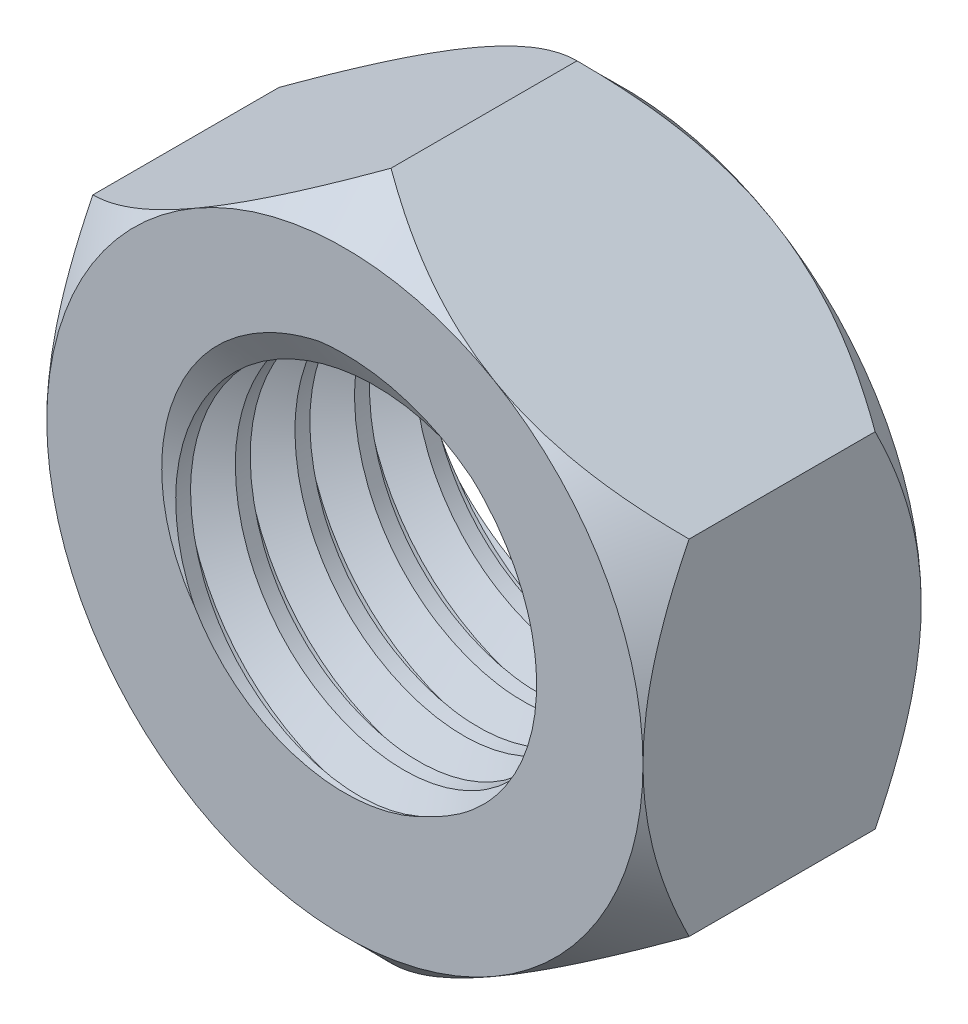
from build123d import *

# Parameters (mm, degrees)
SKETCH1_R               = 1.75
BOSS_EXTRUDE1_DEPTH     = 1.4
SKETCH3_OUTSIDE_W       = 15.516
SKETCH3_OUTSIDE_H       = 16.444
SKETCH3_OUTSIDE_R       = 3
CUT_EXTRUDE1_DEPTH      = 2.8
CUT_EXTRUDE1_DRAFT      = -45
MIRROR1_COPY_1_SKETCH_W = 15.516
MIRROR1_COPY_1_SKETCH_H = 16.444
MIRROR1_COPY_1_SKETCH_R = 3
MIRROR1_COPY_1_DEPTH    = 2.8
MIRROR1_COPY_1_DRAFT    = -45
THREAD1_PITCH           = 0.6


with BuildPart() as part:
    # Sketch1 → Boss-Extrude1 (new, symmetric)
    with BuildSketch(Plane.XY):
        Polygon((0, -3.464101615), (3, -1.732050808), (3, 1.732050808), (0, 3.464101615), (-3, 1.732050808), (-3, -1.732050808), align=None)
        Circle(SKETCH1_R, mode=Mode.SUBTRACT)
    extrude(amount=BOSS_EXTRUDE1_DEPTH, both=True)


with BuildPart() as cut_extrude1_tool:
    # Sketch3 outside → Cut-Extrude1 (with draft: the straight prism first)
    with BuildSketch(Plane.XY.offset(1.4)):
        Rectangle(SKETCH3_OUTSIDE_W, SKETCH3_OUTSIDE_H)
        Circle(SKETCH3_OUTSIDE_R, mode=Mode.SUBTRACT)
    extrude(amount=-CUT_EXTRUDE1_DEPTH)
    # Cut-Extrude1: the draft: its side faces are tilted about the plane it starts from
    cut_extrude1_sides = [cut_extrude1_tool.faces().sort_by_distance(p)[0] for p in [
        (0, -8.222, 0),
        (7.758, 0, 0),
        (0, 8.222, 0),
        (-7.758, 0, 0),
        (-3, 0, 0),
    ]]
    draft(cut_extrude1_sides, Plane.XY.offset(1.4), CUT_EXTRUDE1_DRAFT)


with BuildPart() as part_1:
    add(part.part)

    # Cut-Extrude1: cut by cut_extrude1_tool
    add(cut_extrude1_tool.part, mode=Mode.SUBTRACT)


with BuildPart() as mirror1_copy_1_tool:
    # Mirror1 copy 1 sketch → Mirror1 copy 1 (with draft: the straight prism first)
    with BuildSketch(Plane(origin=(0, 0, -1.4), x_dir=(1, 0, 0), z_dir=(0, 0, -1))):
        Rectangle(MIRROR1_COPY_1_SKETCH_W, MIRROR1_COPY_1_SKETCH_H)
        Circle(MIRROR1_COPY_1_SKETCH_R, mode=Mode.SUBTRACT)
    extrude(amount=-MIRROR1_COPY_1_DEPTH)
    # Mirror1 copy 1: the draft: its side faces are tilted about the plane it starts from
    mirror1_copy_1_sides = [mirror1_copy_1_tool.faces().sort_by_distance(p)[0] for p in [
        (0, -8.222, 0),
        (7.758, 0, 0),
        (0, 8.222, 0),
        (-7.758, 0, 0),
        (-3, 0, 0),
    ]]
    draft(mirror1_copy_1_sides, Plane(origin=(0, 0, -1.4), x_dir=(1, 0, 0), z_dir=(0, 0, -1)), MIRROR1_COPY_1_DRAFT)


with BuildPart() as part_2:
    add(part_1.part)

    # Mirror1 copy 1: cut by mirror1_copy_1_tool
    add(mirror1_copy_1_tool.part, mode=Mode.SUBTRACT)

    # Thread1: the profile of Thread Profile1 profile screwed along a right-hand helix of 6.333333 turns, 6 arcs to a turn; built about Z, then put on its axis
    thread1_z = Axis((0, 0, 0), (0, 0, 1))
    thread1_corners = [(1.7497, 0, -0.000173205), (2.074759525, 0, 0.187499999), (2.074759525, 0, 0.262499999), (1.7497, 0, 0.450173203)]
    with BuildLine(mode=Mode.PRIVATE) as thread1_profile:
        Line(thread1_corners[0], thread1_corners[1])
        Line(thread1_corners[1], thread1_corners[2])
        Line(thread1_corners[2], thread1_corners[3])
        Line(thread1_corners[3], thread1_corners[0])
    thread1_cap = Face(thread1_profile.wire())
    thread1_turn_angles = [0, 30, 60, 90, 120, 150, 180, 210, 240, 270, 300, 330, 360]
    thread1_turn_weights = [1, 0.8660254037844387, 1, 0.8660254037844387, 1, 0.8660254037844387, 1, 0.8660254037844387, 1, 0.8660254037844387, 1, 0.8660254037844387, 1]
    thread1_turn_rails = [Edge.make_bspline([Vector(p[0], p[1], 0).rotate(thread1_z, thread1_turn_angles[k]) / thread1_turn_weights[k] + Vector(0, 0, p[2] + THREAD1_PITCH * thread1_turn_angles[k] / 360) for k in range(13)], [0, 0, 0, 1, 1, 2, 2, 3, 3, 4, 4, 5, 5, 6, 6, 6], 2, thread1_turn_weights) for p in thread1_corners]
    thread1_turn_sides = [Face.make_surface_from_curves(thread1_turn_rails[p[0]], thread1_turn_rails[p[1]]) for p in [(0, 1), (1, 2), (2, 3), (3, 0)]]
    thread1_last_angles = [2160, 2190, 2220, 2250, 2280]
    thread1_last_weights = [1, 0.8660254037844387, 1, 0.8660254037844387, 1]
    thread1_last_rails = [Edge.make_bspline([Vector(p[0], p[1], 0).rotate(thread1_z, thread1_last_angles[k]) / thread1_last_weights[k] + Vector(0, 0, p[2] + THREAD1_PITCH * thread1_last_angles[k] / 360) for k in range(5)], [0, 0, 0, 1, 1, 2, 2, 2], 2, thread1_last_weights) for p in thread1_corners]
    thread1_last_sides = [Face.make_surface_from_curves(thread1_last_rails[p[0]], thread1_last_rails[p[1]]) for p in [(0, 1), (1, 2), (2, 3), (3, 0)]]
    thread1 = Plane(origin=(0, 0, 2.4), x_dir=(-1, 0, 0), z_dir=(0, 0, -1)) * Solid(Shell([*[p.moved(Location((0, 0, THREAD1_PITCH * i))) for i in range(6) for p in thread1_turn_sides], *thread1_last_sides, thread1_cap, thread1_cap.rotate(thread1_z, 2280).moved(Location((0, 0, THREAD1_PITCH * 2280 / 360)))]))
    add(thread1, mode=Mode.SUBTRACT)


solid = part_2.part
